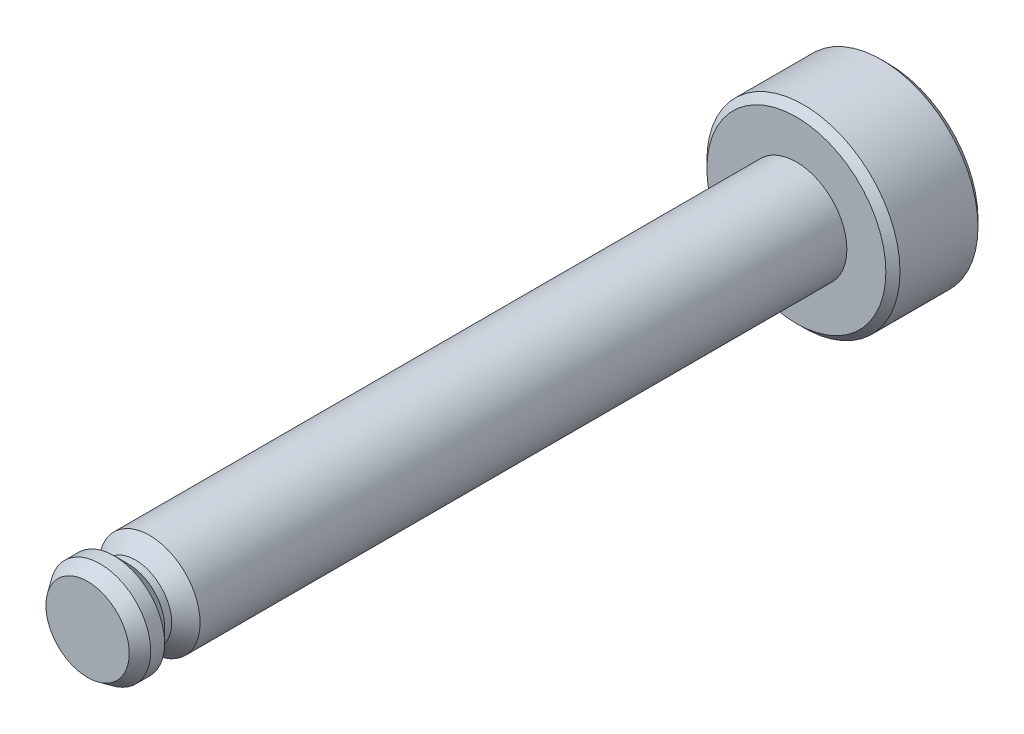
from build123d import *

# Parameters (mm, degrees)
SKETCH2_R      = 1.425
SHAFT_DEPTH    = 20
SKETCH5_R      = 2.725
HEAD_DEPTH     = 2.6
CHAMFER1_SIZE  = 0.25
CHAMFER1_SIZE2 = 0.357037002
DEBURS_SIZE    = 0.2


with BuildPart() as part:
    # Sketch2 → Shaft (new body)
    with BuildSketch(Plane.XY):
        Circle(SKETCH2_R)
    extrude(amount=SHAFT_DEPTH)

    # Sketch5 → Head (add)
    with BuildSketch(Plane.XY):
        Circle(SKETCH5_R)
    extrude(amount=-HEAD_DEPTH)

    # Sketch4 → e-Clip Notch (revolve, cut)
    with BuildSketch(Plane(origin=(0, 0, 0), x_dir=(0, 0, -1), z_dir=(1, 0, 0))):
        Polygon((-19.25, 1.425), (-18.25, 1.425), (-18.65, 1.025), (-18.85, 1.025), align=None)
    revolve(axis=Axis((0, 0, 0), (0, 0, 1)), mode=Mode.SUBTRACT)

    # Chamfer1
    chamfer1_edges = [part.edges().sort_by_distance(p)[0] for p in [
        (-1.425, 0, 20),
    ]]
    chamfer1_side = [part.faces().sort_by_distance(p)[0] for p in [
        (0, 0, 20),
    ]]
    chamfer(chamfer1_edges, length=CHAMFER1_SIZE, length2=CHAMFER1_SIZE2, reference=chamfer1_side[0])

    # Deburs
    deburs_edges = [part.edges().sort_by_distance(p)[0] for p in [
        (-2.725, 0, 0),
        (-2.725, 0, -2.6),
    ]]
    chamfer(deburs_edges, length=DEBURS_SIZE)


solid = part.part
